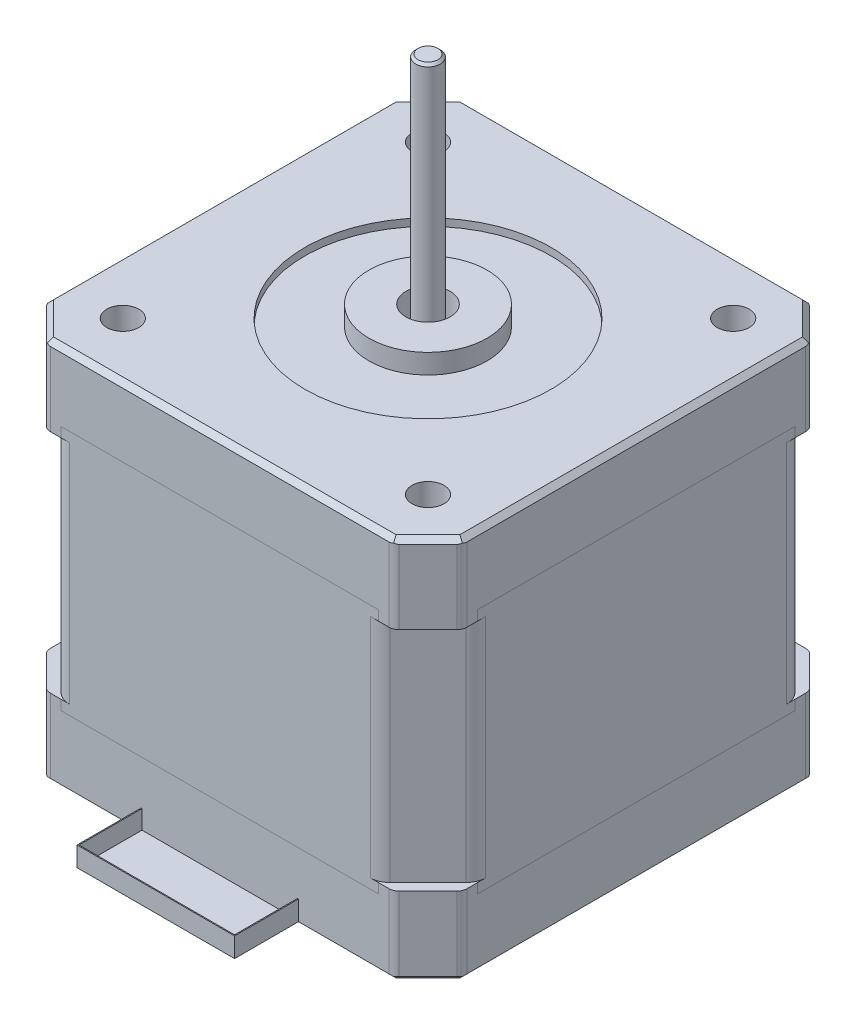
from build123d import *

# Parameters (mm, degrees)
BOSS_EXTRUDE1_DEPTH  = 8
SKETCH2_R            = 1.624765057
CUT_EXTRUDE1_DEPTH   = 6
CHAMFER1_SIZE        = 0.5
SKETCH3_W            = 32.228932188
SKETCH3_H            = 1
CUT_EXTRUDE2_DEPTH   = 48.964700562
SKETCH4_W            = 32.228932188
SKETCH4_H            = 1
CUT_EXTRUDE3_DEPTH   = 48.964700562
CUT_EXTRUDE4_DEPTH   = 1
MIRROR2_COPY_1_DEPTH = 1
MIRROR2_COPY_2_DEPTH = 1
BOSS_EXTRUDE2_DEPTH  = 24
BOSS_EXTRUDE4_DEPTH  = 8
SKETCH22_W           = 16
SKETCH22_H           = 2.5
BOSS_EXTRUDE5_DEPTH  = 6.5
CHAMFER3_SIZE        = 0.5
SKETCH23_W           = 15.8
SKETCH23_H           = 6.4
CUT_EXTRUDE5_DEPTH   = 1.9
SKETCH24_R           = 12.5
CUT_EXTRUDE6_DEPTH   = 0.75
SKETCH25_R           = 6
BOSS_EXTRUDE6_DEPTH  = 2
SKETCH26_R           = 2.25
CUT_EXTRUDE7_DEPTH   = 5
SKETCH27_R           = 1.25207439
BOSS_EXTRUDE7_DEPTH  = 27
CHAMFER5_SIZE        = 0.25
FILLET1_R            = 2
FILLET3_R            = 1
FILLET4_R            = 1


with BuildPart() as part:
    # Sketch1 → Boss-Extrude1 (new body)
    with BuildSketch(Plane(origin=(0, 0, 0), x_dir=(1, 0, 0), z_dir=(0, 1, 0))):
        Polygon((-21.15, -17.614466094), (-21.15, 17.614466094), (-17.614466094, 21.15), (17.614466094, 21.15), (21.15, 17.614466094), (21.15, -17.614466094), (17.614466094, -21.15), (-17.614466094, -21.15), align=None)
    extrude(amount=-BOSS_EXTRUDE1_DEPTH)

    # Sketch2 → Cut-Extrude1 (cut)
    with BuildSketch(Plane(origin=(0, 0, 0), x_dir=(1, 0, 0), z_dir=(0, 1, 0))):
        with Locations((-15.5, 15.5)):
            Circle(SKETCH2_R)
        with Locations((15.5, 15.5)):
            Circle(SKETCH2_R)
        with Locations((15.5, -15.5)):
            Circle(SKETCH2_R)
        with Locations((-15.5, -15.5)):
            Circle(SKETCH2_R)
    extrude(amount=-CUT_EXTRUDE1_DEPTH, mode=Mode.SUBTRACT)

    # Chamfer1
    chamfer1_edges = [part.edges().sort_by_distance(p)[0] for p in [
        (-21.15, 0, 0),
        (-19.382233047, 0, -19.382233047),
        (0, 0, -21.15),
        (19.382233047, 0, -19.382233047),
        (21.15, 0, 0),
        (19.382233047, 0, 19.382233047),
        (0, 0, 21.15),
        (-19.382233047, 0, 19.382233047),
    ]]
    chamfer(chamfer1_edges, length=CHAMFER1_SIZE)

    # Sketch3 → Cut-Extrude2 (cut, through all)
    with BuildSketch(Plane(origin=(21.15, 0, 0), x_dir=(0, 0, -1), z_dir=(1, 0, 0))):
        with Locations((0, -7.5)):
            Rectangle(SKETCH3_W, SKETCH3_H)
    extrude(amount=-CUT_EXTRUDE2_DEPTH, mode=Mode.SUBTRACT)

    # Sketch4 → Cut-Extrude3 (cut, through all)
    with BuildSketch(Plane.XY.offset(21.15)):
        with Locations((0, -7.5)):
            Rectangle(SKETCH4_W, SKETCH4_H)
    extrude(amount=-CUT_EXTRUDE3_DEPTH, mode=Mode.SUBTRACT)

    # Sketch5 → Cut-Extrude4 (cut)
    with BuildSketch(Plane.XZ.offset(8)):
        Polygon((-21.15, 16.114466094), (-16.114466094, 21.15), (-16.114466094, 16.114466094), align=None)
    cut_extrude4 = extrude(amount=-CUT_EXTRUDE4_DEPTH, mode=Mode.SUBTRACT)

    # Mirror1: Cut-Extrude4 across plane
    add(cut_extrude4.mirror(Plane(origin=(0, 0, 0), x_dir=(0, 0, 1), z_dir=(1, 0, 0))), mode=Mode.SUBTRACT)

    # Mirror2 copy 1 sketch → Mirror2 copy 1 (cut)
    with BuildSketch(Plane(origin=(0, -8, 0), x_dir=(-1, 0, 0), z_dir=(0, -1, 0))):
        Polygon((-21.15, 16.114466094), (-16.114466094, 21.15), (-16.114466094, 16.114466094), align=None)
    extrude(amount=-MIRROR2_COPY_1_DEPTH, mode=Mode.SUBTRACT)

    # Mirror2 copy 2 sketch → Mirror2 copy 2 (cut)
    with BuildSketch(Plane.XZ.offset(8)):
        Polygon((-21.15, -16.114466094), (-16.114466094, -21.15), (-16.114466094, -16.114466094), align=None)
    extrude(amount=-MIRROR2_COPY_2_DEPTH, mode=Mode.SUBTRACT)

    # Sketch6 → Boss-Extrude2 (add)
    with BuildSketch(Plane.XZ.offset(7)):
        Polygon((-21.15, -16.114466094), (-21.15, 16.114466094), (-16.114466094, 21.15), (16.114466094, 21.15), (21.15, 16.114466094), (21.15, -16.114466094), (16.114466094, -21.15), (-16.114466094, -21.15), align=None)
    extrude(amount=BOSS_EXTRUDE2_DEPTH)

    # Sketch16 → Boss-Extrude4 (add)
    with BuildSketch(Plane.XZ.offset(31)):
        Polygon((-21.15, -17.614466094), (-21.15, 17.614466094), (-17.614466094, 21.15), (17.614466094, 21.15), (21.15, 17.614466094), (21.15, -17.614466094), (17.614466094, -21.15), (-17.614466094, -21.15), align=None)
    extrude(amount=BOSS_EXTRUDE4_DEPTH)

    # Sketch22 → Boss-Extrude5 (add)
    with BuildSketch(Plane.XY.offset(21.15)):
        with Locations((0, -37.75)):
            Rectangle(SKETCH22_W, SKETCH22_H)
    extrude(amount=BOSS_EXTRUDE5_DEPTH)

    # Chamfer3
    chamfer3_edges = [part.edges().sort_by_distance(p)[0] for p in [
        (-21.15, -39, 0),
        (-19.382233047, -39, 19.382233047),
        (-12.807233047, -39, 21.15),
        (-8, -39, 24.4),
        (0, -39, 27.65),
        (8, -39, 24.4),
        (12.807233047, -39, 21.15),
        (19.382233047, -39, 19.382233047),
        (21.15, -39, 0),
        (19.382233047, -39, -19.382233047),
        (0, -39, -21.15),
        (-19.382233047, -39, -19.382233047),
    ]]
    chamfer(chamfer3_edges, length=CHAMFER3_SIZE)

    # Sketch23 → Cut-Extrude5 (cut)
    with BuildSketch(Plane(origin=(0, -36.5, 0), x_dir=(1, 0, 0), z_dir=(0, 1, 0))):
        with Locations((0, -24.35)):
            Rectangle(SKETCH23_W, SKETCH23_H)
    extrude(amount=-CUT_EXTRUDE5_DEPTH, mode=Mode.SUBTRACT)

    # Sketch24 → Cut-Extrude6 (cut)
    with BuildSketch(Plane(origin=(0, 0, 0), x_dir=(1, 0, 0), z_dir=(0, 1, 0))):
        Circle(SKETCH24_R)
    extrude(amount=-CUT_EXTRUDE6_DEPTH, mode=Mode.SUBTRACT)

    # Sketch25 → Boss-Extrude6 (add)
    with BuildSketch(Plane(origin=(0, -0.75, 0), x_dir=(1, 0, 0), z_dir=(0, 1, 0))):
        Circle(SKETCH25_R)
    extrude(amount=BOSS_EXTRUDE6_DEPTH)

    # Sketch26 → Cut-Extrude7 (cut)
    with BuildSketch(Plane(origin=(0, 1.25, 0), x_dir=(1, 0, 0), z_dir=(0, 1, 0))):
        Circle(SKETCH26_R)
    extrude(amount=-CUT_EXTRUDE7_DEPTH, mode=Mode.SUBTRACT)

    # Sketch27 → Boss-Extrude7 (add)
    with BuildSketch(Plane(origin=(0, -3.75, 0), x_dir=(1, 0, 0), z_dir=(0, 1, 0))):
        Circle(SKETCH27_R)
    extrude(amount=BOSS_EXTRUDE7_DEPTH)

    # Chamfer5
    chamfer5_edges = [part.edges().sort_by_distance(p)[0] for p in [
        (-1.25207439, 23.25, 0),
    ]]
    chamfer(chamfer5_edges, length=CHAMFER5_SIZE)

    # Fillet1
    fillet1_edges = [part.edges().sort_by_distance(p)[0] for p in [
        (-16.114466094, -19.5, 21.15),
        (-21.15, -19.5, 16.114466094),
        (-21.15, -19.5, -16.114466094),
        (-16.114466094, -19.5, -21.15),
        (21.15, -19.5, -16.114466094),
        (16.114466094, -19.5, -21.15),
        (21.15, -19.5, 16.114466094),
        (16.114466094, -19.5, 21.15),
    ]]
    fillet(fillet1_edges, radius=FILLET1_R)

    # Fillet3
    fillet3_edges = [part.edges().sort_by_distance(p)[0] for p in [
        (-17.614466094, -4.25, 21.15),
        (-21.15, -4.25, 17.614466094),
        (-21.15, -4.25, -17.614466094),
        (-17.614466094, -4.25, -21.15),
        (17.614466094, -4.25, -21.15),
        (21.15, -4.25, -17.614466094),
        (17.614466094, -4.25, 21.15),
        (21.15, -4.25, 17.614466094),
    ]]
    fillet(fillet3_edges, radius=FILLET3_R)

    # Fillet4
    fillet4_edges = [part.edges().sort_by_distance(p)[0] for p in [
        (-17.614466094, -34.75, 21.15),
        (-21.15, -34.75, 17.614466094),
        (-21.15, -34.75, -17.614466094),
        (-17.614466094, -34.75, -21.15),
        (17.614466094, -34.75, -21.15),
        (21.15, -34.75, -17.614466094),
        (21.15, -34.75, 17.614466094),
        (17.614466094, -34.75, 21.15),
    ]]
    fillet(fillet4_edges, radius=FILLET4_R)


solid = part.part
